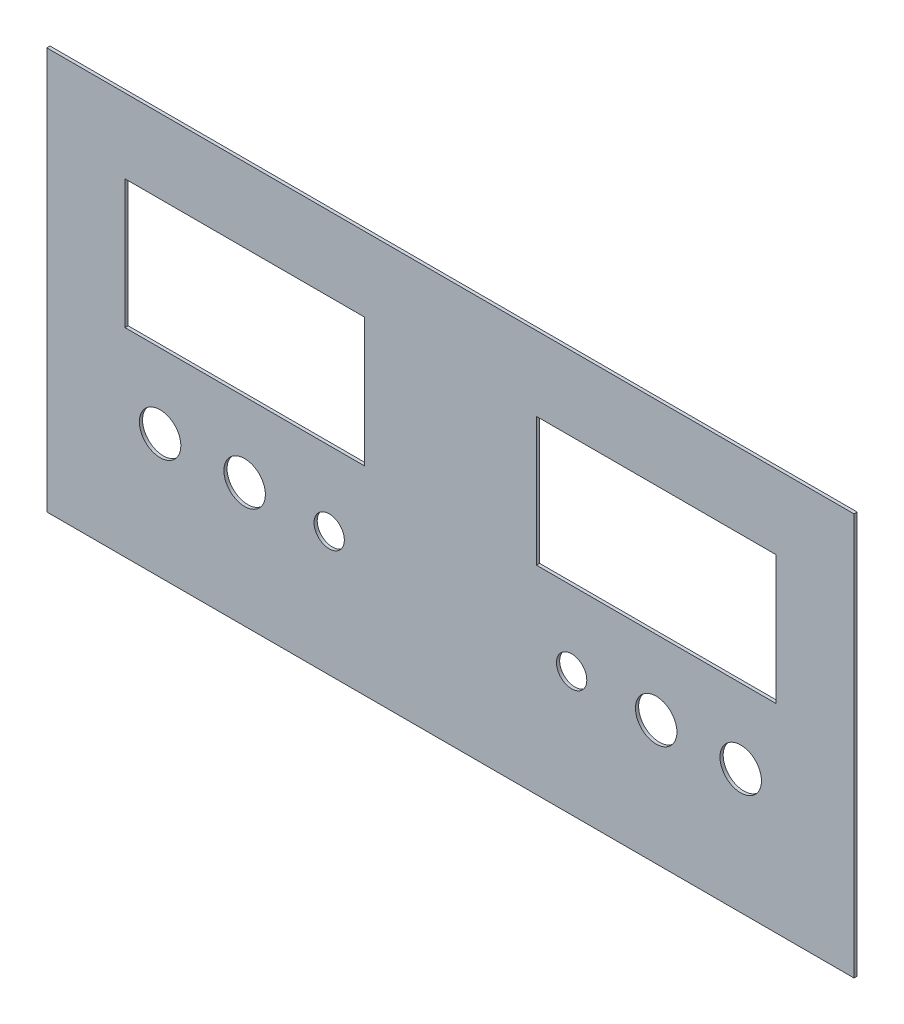
from build123d import *

# Parameters (mm, degrees)
SKETCH1_W          = 253
SKETCH1_H          = 126
BASE_FLANGE1_DEPTH = 1
SKETCH2_R          = 6.5
SKETCH2_R_2        = 4.75
SKETCH2_W          = 75
SKETCH2_H          = 40.400000001
SKETCH2_H_2        = 40.4
CUT_EXTRUDE1_DEPTH = 10


# Sheet-metal steps are written as plain solids
with BuildPart() as part:
    # Sketch1 → Base-Flange1 (new body)
    with BuildSketch(Plane.XY):
        Rectangle(SKETCH1_W, SKETCH1_H)
    extrude(amount=-BASE_FLANGE1_DEPTH)

    # Sketch2 → Cut-Extrude1 (cut)
    with BuildSketch(Plane(origin=(0, 0, -1), x_dir=(-1, 0, 0), z_dir=(0, 0, -1))):
        with Locations((-91, -24)):
            Circle(SKETCH2_R)
        with Locations((-64.5, -24)):
            Circle(SKETCH2_R)
        with Locations((64.5, -24)):
            Circle(SKETCH2_R)
        with Locations((91, -24)):
            Circle(SKETCH2_R)
        with Locations((-38, -24)):
            Circle(SKETCH2_R_2)
        with Locations((38, -24)):
            Circle(SKETCH2_R_2)
        with Locations((-64.5, 19.5)):
            Rectangle(SKETCH2_W, SKETCH2_H)
        with Locations((64.5, 19.5)):
            Rectangle(SKETCH2_W, SKETCH2_H_2)
    extrude(amount=-CUT_EXTRUDE1_DEPTH, mode=Mode.SUBTRACT)


solid = part.part
